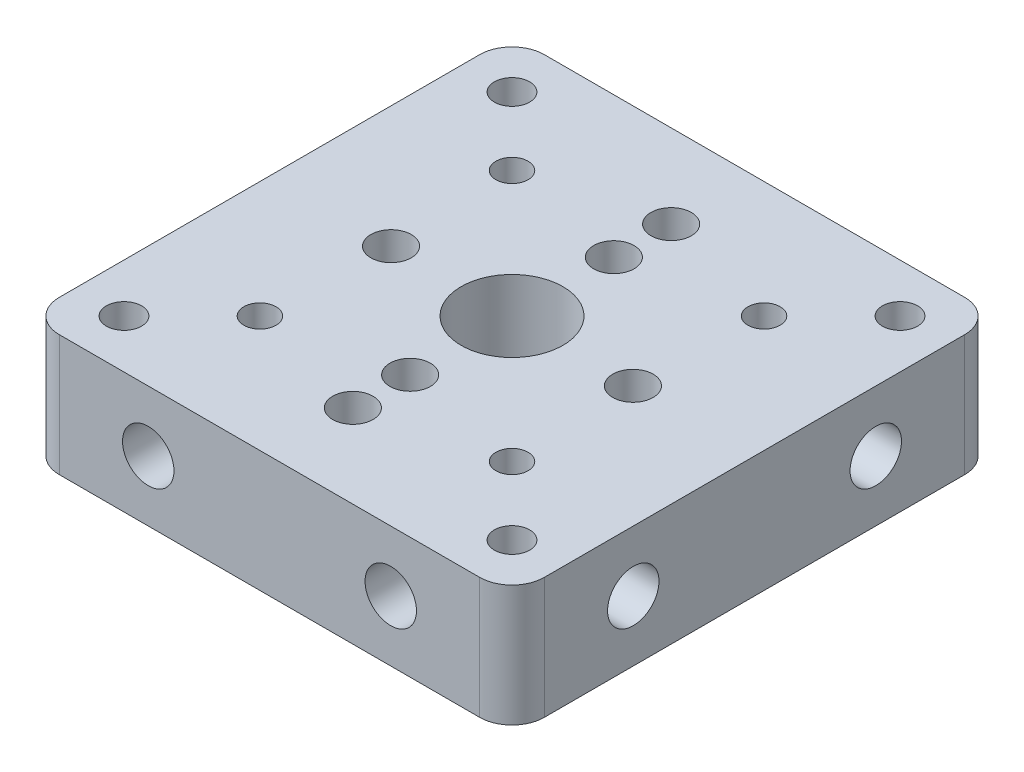
from build123d import *

# Parameters (mm, degrees)
SKETCH1_W           = 38.1
SKETCH1_H           = 38.1
SKETCH1_R           = 1.2645
SKETCH1_R_2         = 1.5875
SKETCH1_R_3         = 4
SKETCH1_R_4         = 1.3843
BOSS_EXTRUDE1_DEPTH = 4.7625
SKETCH4_R           = 2.0193
CUT_EXTRUDE2_DEPTH  = 9.525
CIRPATTERN1_COUNT   = 4
FILLET1_R           = 2.54


with BuildPart() as part:
    # Sketch1 → Boss-Extrude1 (new, symmetric)
    with BuildSketch(Plane(origin=(0, 0, 0), x_dir=(1, 0, 0), z_dir=(0, 1, 0))):
        Rectangle(SKETCH1_W, SKETCH1_H)
        with Locations((-9.899494937, -9.899494937)):
            Circle(SKETCH1_R, mode=Mode.SUBTRACT)
        with Locations((0, -8)):
            Circle(SKETCH1_R_2, mode=Mode.SUBTRACT)
        Circle(SKETCH1_R_3, mode=Mode.SUBTRACT)
        with Locations((9.899494937, 9.899494937)):
            Circle(SKETCH1_R, mode=Mode.SUBTRACT)
        with Locations((0, 8)):
            Circle(SKETCH1_R_2, mode=Mode.SUBTRACT)
        with Locations((9.899494937, -9.899494937)):
            Circle(SKETCH1_R, mode=Mode.SUBTRACT)
        with Locations((0, -12.5)):
            Circle(SKETCH1_R_2, mode=Mode.SUBTRACT)
        with Locations((-9.5, 0)):
            Circle(SKETCH1_R_2, mode=Mode.SUBTRACT)
        with Locations((-15.24, 15.24)):
            Circle(SKETCH1_R_4, mode=Mode.SUBTRACT)
        with Locations((15.24, 15.24)):
            Circle(SKETCH1_R_4, mode=Mode.SUBTRACT)
        with Locations((15.24, -15.24)):
            Circle(SKETCH1_R_4, mode=Mode.SUBTRACT)
        with Locations((-15.24, -15.24)):
            Circle(SKETCH1_R_4, mode=Mode.SUBTRACT)
        with Locations((9.5, 0)):
            Circle(SKETCH1_R_2, mode=Mode.SUBTRACT)
        with Locations((-9.899494937, 9.899494937)):
            Circle(SKETCH1_R, mode=Mode.SUBTRACT)
        with Locations((0, 12.5)):
            Circle(SKETCH1_R_2, mode=Mode.SUBTRACT)
    extrude(amount=BOSS_EXTRUDE1_DEPTH, both=True)

    # Sketch4 → Cut-Extrude2 (cut)
    with BuildSketch(Plane.XY.offset(19.05)):
        with Locations((-9.525, 0)):
            Circle(SKETCH4_R)
        with Locations((9.525, 0)):
            Circle(SKETCH4_R)
    cut_extrude2 = extrude(amount=-CUT_EXTRUDE2_DEPTH, mode=Mode.SUBTRACT)

    # CirPattern1: Cut-Extrude2 ×4 about axis
    cirpattern1_axis = Axis((0, 4.7625, 0), (0, -1, 0))
    for i in range(1, CIRPATTERN1_COUNT):
        add(cut_extrude2.rotate(cirpattern1_axis, i * 360 / CIRPATTERN1_COUNT), mode=Mode.SUBTRACT)

    # Fillet1
    fillet1_edges = [part.edges().sort_by_distance(p)[0] for p in [
        (-19.05, 0, 19.05),
        (-19.05, 0, -19.05),
        (19.05, 0, -19.05),
        (19.05, 0, 19.05),
    ]]
    fillet(fillet1_edges, radius=FILLET1_R)


solid = part.part
